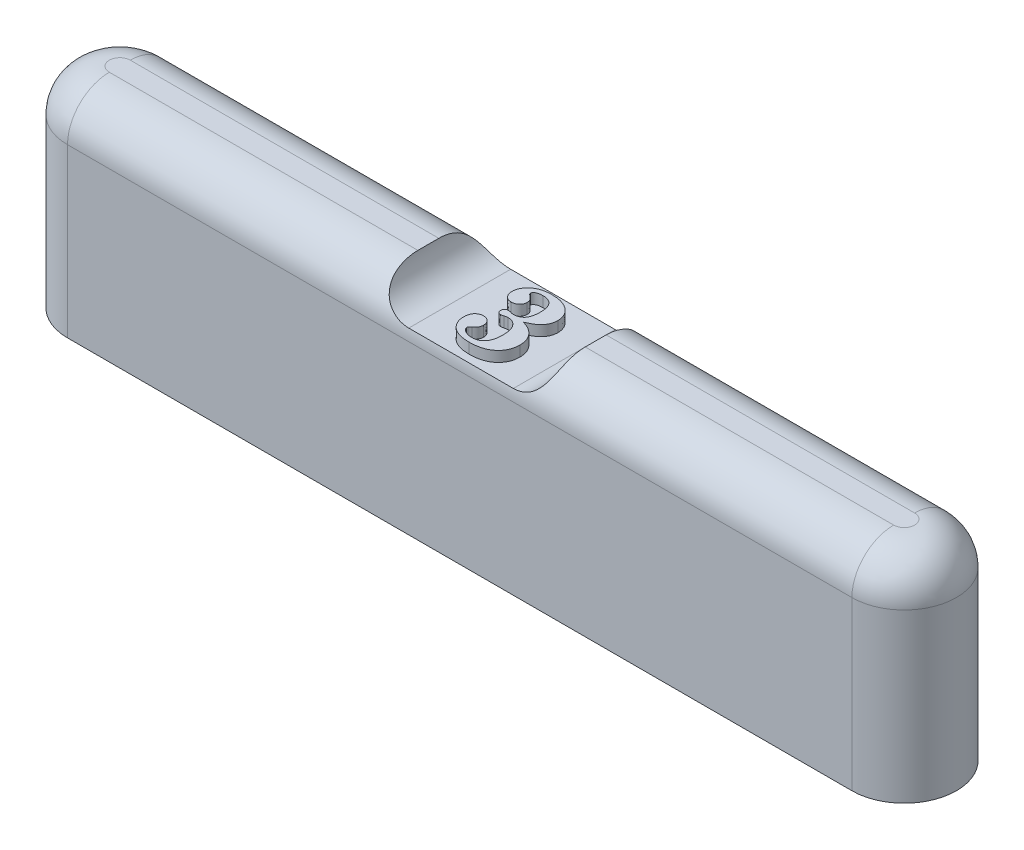
from build123d import *

# Parameters (mm, degrees)
BOSS_EXTRUDE1_DEPTH     = 20
FILLET1_R               = 4
SKETCH2_R               = 2.75
CUT_EXTRUDE1_DEPTH      = 1.5
LPATTERN1_COUNT         = 3
LPATTERN1_PITCH         = 30
CUT_EXTRUDE2_DEPTH      = 48.236109069
CUT_EXTRUDE2_DEPTH_BACK = 48.236109069
WRAP1_DEPTH             = 1


# Read off the part's stored shape, not the designer's step: Wrap1
with BuildPart() as part:
    # Sketch1 → Boss-Extrude1 (new body)
    with BuildSketch(Plane(origin=(0, 0, 0), x_dir=(1, 0, 0), z_dir=(0, 1, 0))):
        with BuildLine():
            Line((37.5, -5), (-37.5, -5))
            ThreePointArc((-37.5, -5), (-42.5, 0), (-37.5, 5))
            Line((-37.5, 5), (37.5, 5))
            ThreePointArc((37.5, 5), (42.5, 0), (37.5, -5))
        make_face()
    extrude(amount=BOSS_EXTRUDE1_DEPTH)

    # Fillet1
    fillet1_edges = [part.edges().sort_by_distance(p)[0] for p in [
        (-42.5, 20, 0),
        (0, 20, 5),
        (42.5, 20, 0),
        (0, 20, -5),
    ]]
    fillet(fillet1_edges, radius=FILLET1_R)

    # Sketch2 → Cut-Extrude1 (cut)
    with BuildSketch(Plane.XZ):
        with Locations(Location((-37.5, 0, 0), (0, 0, 270))):
            Circle(SKETCH2_R)
    cut_extrude1 = extrude(amount=-CUT_EXTRUDE1_DEPTH, mode=Mode.SUBTRACT)

    # LPattern1: Cut-Extrude1 ×3
    with Locations(*[(i * LPATTERN1_PITCH, 0, 0) for i in range(1, LPATTERN1_COUNT)]):
        add(cut_extrude1, mode=Mode.SUBTRACT)

    # Sketch3 → Cut-Extrude2 (cut, two sides: drawn at the far end of the back side and taken through both)
    with BuildSketch(Plane.XY.offset(-CUT_EXTRUDE2_DEPTH_BACK)):
        with BuildLine():
            Line((-5, 23), (5, 23))
            ThreePointArc((5, 23), (8, 20), (5, 17))
            Line((5, 17), (-5, 17))
            ThreePointArc((-5, 17), (-8, 20), (-5, 23))
        make_face()
    extrude(amount=CUT_EXTRUDE2_DEPTH + CUT_EXTRUDE2_DEPTH_BACK, mode=Mode.SUBTRACT)

    # Wrap1 outline → Wrap1 (add)
    with BuildSketch(Plane(origin=(0, 17, 0), x_dir=(1, 0, 0), z_dir=(0, 1, 0))):
        with BuildLine():
            add(Edge.make_bspline(
                [(2.71716785, -1.961133355), (2.714917104, -2.040824799), (2.710502566, -2.197128893), (2.67861502, -2.426281229), (2.62223098, -2.643199541), (2.544100586, -2.848537817), (2.447812244, -3.0439371), (2.322849444, -3.224002982), (2.180633182, -3.395136153), (2.01516107, -3.55167345), (1.830391864, -3.692905147), (1.62760187, -3.816901803), (1.406671678, -3.921188949), (1.168256673, -4.006025687), (0.912348982, -4.071645075), (0.638852791, -4.116939862), (0.348169875, -4.146841164), (0.148335851, -4.150142693), (0.045693491, -4.151838484)],
                knots=[0, 0, 0, 0, 0.061354375, 0.120338389, 0.177702509, 0.233546768, 0.289283374, 0.3449562, 0.401886605, 0.460365064, 0.51992708, 0.580664812, 0.643036542, 0.707697668, 0.775236972, 0.846171603, 0.920987881, 1, 1, 1, 1], degree=3))
            add(Edge.make_bspline(
                [(0.979988362, 0.104571773), (1.050344195, 0.084333241), (1.187855479, 0.044776797), (1.38338152, -0.032288072), (1.566774228, -0.114444049), (1.736010108, -0.207951529), (1.891498578, -0.310848663), (2.035801669, -0.421421094), (2.16517559, -0.543217003), (2.281148573, -0.67385047), (2.383953498, -0.811421355), (2.472334741, -0.956623945), (2.547868662, -1.107801761), (2.611203194, -1.265594984), (2.658869622, -1.430514228), (2.692271377, -1.602161077), (2.713987686, -1.779484024), (2.716100586, -1.900171809), (2.71716785, -1.961133355)],
                knots=[0, 0, 0, 0, 0.075025699, 0.146638589, 0.215271416, 0.280976256, 0.344630791, 0.406315274, 0.467154943, 0.526516949, 0.585236113, 0.643010064, 0.700575913, 0.758349864, 0.817112444, 0.876302356, 0.937518121, 1, 1, 1, 1], degree=3))
            add(Edge.make_bspline(
                [(2.512039645, 1.873802542), (2.507752888, 1.783117182), (2.499290838, 1.604104405), (2.430689157, 1.342964417), (2.318742743, 1.097294696), (2.189931591, 0.906145149), (2.062985591, 0.763780615), (1.953872264, 0.656100386), (1.826201212, 0.557059706), (1.686306897, 0.457935667), (1.530719309, 0.364733719), (1.361259895, 0.272161711), (1.176466601, 0.184873408), (1.046483942, 0.131748847), (0.979988362, 0.104571773)],
                knots=[0, 0, 0, 0, 0.108587554, 0.214351684, 0.321241858, 0.430999345, 0.489069076, 0.549749196, 0.614451706, 0.682490285, 0.755190336, 0.831693801, 0.913899143, 1, 1, 1, 1], degree=3))
            add(Edge.make_bspline(
                [(0.076142209, 3.745597414), (0.198623899, 3.742577347), (0.435971189, 3.736725007), (0.778771911, 3.690157693), (1.095872568, 3.61249552), (1.38452983, 3.501222139), (1.645028465, 3.366120608), (1.87357069, 3.206135522), (2.07031953, 3.024795652), (2.229101748, 2.819264052), (2.354764574, 2.599539567), (2.445498637, 2.367525244), (2.502689235, 2.124431927), (2.50889903, 1.957983921), (2.512039645, 1.873802542)],
                knots=[0, 0, 0, 0, 0.10695053, 0.207250721, 0.301516556, 0.391461648, 0.476821793, 0.557207781, 0.634455968, 0.709589712, 0.783146573, 0.854802433, 0.926566069, 1, 1, 1, 1], degree=3))
            add(Edge.make_bspline(
                [(-1.645011638, 3.139828183), (-1.594468049, 3.188877347), (-1.493220715, 3.287131096), (-1.316714827, 3.408447203), (-1.125380916, 3.51272976), (-0.917956932, 3.600001044), (-0.693066625, 3.6654117), (-0.451501775, 3.710835437), (-0.193290785, 3.740577598), (-0.015290072, 3.743893936), (0.076142209, 3.745597414)],
                knots=[0, 0, 0, 0, 0.112520394, 0.225397328, 0.341295234, 0.46082693, 0.584695833, 0.715280351, 0.853750211, 1, 1, 1, 1], degree=3))
            add(Edge.make_bspline(
                [(-2.103344971, 2.098161516), (-2.102441766, 2.14581505), (-2.100645197, 2.240602949), (-2.076062279, 2.38038819), (-2.04240579, 2.517557704), (-1.989270683, 2.649294264), (-1.925424532, 2.778553807), (-1.845948644, 2.9037315), (-1.753447289, 3.026224881), (-1.681585328, 3.101511523), (-1.645011638, 3.139828183)],
                knots=[0, 0, 0, 0, 0.122161592, 0.242992273, 0.363386459, 0.4840848, 0.606730262, 0.733038715, 0.864131742, 1, 1, 1, 1], degree=3))
            add(Edge.make_bspline(
                [(-1.257191125, 1.18149485), (-1.314710293, 1.184409275), (-1.427596664, 1.190129087), (-1.588679247, 1.240165732), (-1.735720252, 1.320849174), (-1.864583577, 1.432842721), (-1.970099917, 1.571134806), (-2.049284152, 1.729434961), (-2.09419553, 1.908246588), (-2.100219002, 2.033275779), (-2.103344971, 2.098161516)],
                knots=[0, 0, 0, 0, 0.123503177, 0.242385729, 0.359144057, 0.482175805, 0.606759678, 0.731136659, 0.860469416, 1, 1, 1, 1], degree=3))
            add(Edge.make_bspline(
                [(-0.46231933, 1.917071773), (-0.465045215, 1.866039045), (-0.47033756, 1.766958294), (-0.513186735, 1.624506628), (-0.587753153, 1.497637073), (-0.686864947, 1.386132483), (-0.806724466, 1.294026757), (-0.944851832, 1.229944533), (-1.096049202, 1.187615829), (-1.202404107, 1.183575936), (-1.257191125, 1.18149485)],
                knots=[0, 0, 0, 0, 0.126444231, 0.245493237, 0.364814777, 0.488720188, 0.613543272, 0.736823611, 0.86442892, 1, 1, 1, 1], degree=3))
            add(Edge.make_bspline(
                [(-0.891806509, 2.602969209), (-0.851169185, 2.571597297), (-0.775806805, 2.51341773), (-0.679029892, 2.422575825), (-0.602225907, 2.340246161), (-0.546837183, 2.26071239), (-0.508420747, 2.181464029), (-0.480849616, 2.099204671), (-0.46453983, 2.010131451), (-0.463072996, 1.948657428), (-0.46231933, 1.917071773)],
                knots=[0, 0, 0, 0, 0.182070801, 0.337652372, 0.470523462, 0.580943793, 0.680135151, 0.782042625, 0.888012428, 1, 1, 1, 1], degree=3))
            add(Edge.make_bspline(
                [(-1.077703945, 2.851366645), (-1.076949137, 2.830851528), (-1.075566528, 2.793273299), (-1.055936533, 2.747828245), (-1.02700902, 2.716673481), (-0.993565957, 2.685437448), (-0.947910496, 2.645971344), (-0.911740687, 2.618248198), (-0.891806509, 2.602969209)],
                knots=[0, 0, 0, 0, 0.188481556, 0.345248003, 0.443161045, 0.579238055, 0.768106505, 1, 1, 1, 1], degree=3))
            add(Edge.make_bspline(
                [(-0.255588561, 3.232776901), (-0.31868658, 3.23127144), (-0.437318295, 3.228440997), (-0.603726114, 3.207011582), (-0.746298777, 3.169225928), (-0.864529306, 3.117242415), (-0.955233103, 3.054230898), (-1.02472101, 2.991923418), (-1.069230117, 2.92343901), (-1.075008016, 2.874296302), (-1.077703945, 2.851366645)],
                knots=[0, 0, 0, 0, 0.19340588, 0.363625855, 0.512994624, 0.644183797, 0.757282422, 0.849945944, 0.929985784, 1, 1, 1, 1], degree=3))
            add(Edge.make_bspline(
                [(0.973578106, 1.731174337), (0.97293017, 1.794790427), (0.971675601, 1.917967291), (0.954268841, 2.095990977), (0.931853715, 2.261260257), (0.89698004, 2.412765664), (0.849932774, 2.549057412), (0.796049717, 2.672989162), (0.729716346, 2.782404622), (0.654264584, 2.879704468), (0.568277029, 2.963293046), (0.474845333, 3.036040371), (0.37312934, 3.09728924), (0.263392601, 3.147072529), (0.145214104, 3.186031879), (0.018755775, 3.21187131), (-0.115578033, 3.231235003), (-0.207969248, 3.232252482), (-0.255588561, 3.232776901)],
                knots=[0, 0, 0, 0, 0.085873572, 0.166272986, 0.241360724, 0.311004539, 0.375793903, 0.435856468, 0.493138333, 0.548120936, 0.601684393, 0.654642041, 0.707717483, 0.761629576, 0.81706464, 0.875359625, 0.935759162, 1, 1, 1, 1], degree=3))
            add(Edge.make_bspline(
                [(0.681911439, 0.601366645), (0.70577303, 0.631197995), (0.754921033, 0.692641985), (0.813582654, 0.800185855), (0.862717838, 0.921442685), (0.904980331, 1.0557357), (0.933662249, 1.205403777), (0.958903946, 1.367709581), (0.970435253, 1.545115027), (0.972504183, 1.667597284), (0.973578106, 1.731174337)],
                knots=[0, 0, 0, 0, 0.096159815, 0.198061519, 0.307357594, 0.425781566, 0.552299199, 0.691147288, 0.839683351, 1, 1, 1, 1], degree=3))
            add(Edge.make_bspline(
                [(-0.140203945, 0.258417927), (-0.097412529, 0.259151519), (-0.014177564, 0.260578455), (0.107140941, 0.277162029), (0.221219027, 0.303814252), (0.327818055, 0.342991481), (0.42763247, 0.391325014), (0.521894957, 0.448669277), (0.6068836, 0.519677489), (0.656850704, 0.574080902), (0.681911439, 0.601366645)],
                knots=[0, 0, 0, 0, 0.139400172, 0.271151778, 0.398277016, 0.520563852, 0.640497354, 0.759364307, 0.879310449, 1, 1, 1, 1], degree=3))
            add(Edge.make_bspline(
                [(-0.443088561, 0.317712798), (-0.38691904, 0.300302005), (-0.287976995, 0.269633068), (-0.18480505, 0.261802899), (-0.140203945, 0.258417927)],
                knots=[0, 0, 0, 0, 0.567701235, 1, 1, 1, 1], degree=3))
            add(Edge.make_bspline(
                [(-0.675460355, 0.360982029), (-0.642189322, 0.358101661), (-0.56339244, 0.35127999), (-0.487142743, 0.330004798), (-0.443088561, 0.317712798)],
                knots=[0, 0, 0, 0, 0.422237936, 1, 1, 1, 1], degree=3))
            add(Edge.make_bspline(
                [(-1.077703945, -0.007607714), (-1.076651413, 0.021368655), (-1.074655984, 0.076303128), (-1.055186126, 0.152455349), (-1.024608651, 0.217623913), (-0.979899521, 0.270761194), (-0.921453993, 0.311004464), (-0.851342202, 0.342893854), (-0.766766712, 0.356629296), (-0.706994786, 0.359478728), (-0.675460355, 0.360982029)],
                knots=[0, 0, 0, 0, 0.138834815, 0.263208175, 0.374439269, 0.481790582, 0.592071981, 0.712606806, 0.848377303, 1, 1, 1, 1], degree=3))
            add(Edge.make_bspline(
                [(-0.73956292, -0.356966689), (-0.764186463, -0.355484102), (-0.81183396, -0.352615241), (-0.880116413, -0.337795434), (-0.939157672, -0.307538914), (-0.990267316, -0.26767505), (-1.028167193, -0.2146499), (-1.058612695, -0.154558809), (-1.073568679, -0.083606212), (-1.076276998, -0.033832342), (-1.077703945, -0.007607714)],
                knots=[0, 0, 0, 0, 0.134273141, 0.259823658, 0.376868709, 0.492678997, 0.608999304, 0.728652424, 0.857033635, 1, 1, 1, 1], degree=3))
            add(Edge.make_bspline(
                [(-0.439883432, -0.308889766), (-0.47079353, -0.316208274), (-0.528634968, -0.329903251), (-0.610117747, -0.343480507), (-0.678911672, -0.354596571), (-0.72083446, -0.356234822), (-0.73956292, -0.356966689)],
                knots=[0, 0, 0, 0, 0.31333056, 0.586329099, 0.81519791, 1, 1, 1, 1], degree=3))
            add(Edge.make_bspline(
                [(-0.112960355, -0.254402586), (-0.135419025, -0.255134396), (-0.183715216, -0.256708115), (-0.260938013, -0.266756025), (-0.347402943, -0.284985971), (-0.40789499, -0.300621587), (-0.439883432, -0.308889766)],
                knots=[0, 0, 0, 0, 0.202759475, 0.436023603, 0.701766965, 1, 1, 1, 1], degree=3))
            add(Edge.make_bspline(
                [(1.076142209, -1.941902586), (1.075385572, -1.872430623), (1.073922469, -1.738093113), (1.057992817, -1.543154122), (1.030202106, -1.363083667), (0.99663082, -1.195650057), (0.94736708, -1.043433794), (0.891377752, -0.903302367), (0.821043402, -0.778853132), (0.74312161, -0.66770404), (0.655108872, -0.571320569), (0.563232457, -0.485769442), (0.463800781, -0.415342262), (0.360982505, -0.35395079), (0.249698445, -0.310067337), (0.133709412, -0.277755689), (0.012185612, -0.257872314), (-0.070684342, -0.255574708), (-0.112960355, -0.254402586)],
                knots=[0, 0, 0, 0, 0.089659443, 0.173373917, 0.252164698, 0.32478559, 0.393476985, 0.458396676, 0.519206122, 0.577557919, 0.633215921, 0.687389211, 0.739248931, 0.790220988, 0.841564769, 0.893088794, 0.94545937, 1, 1, 1, 1], degree=3))
            add(Edge.make_bspline(
                [(-0.204306509, -3.639017971), (-0.156163719, -3.637826694), (-0.061617943, -3.635487191), (0.075877638, -3.616019097), (0.206206359, -3.58418452), (0.327421557, -3.537508138), (0.441326572, -3.478983133), (0.548194212, -3.408571825), (0.645249169, -3.322599832), (0.736665847, -3.226254433), (0.816533134, -3.114286579), (0.888111872, -2.989282534), (0.9437722, -2.848073643), (0.995610517, -2.695342999), (1.030161239, -2.526686493), (1.058173496, -2.344406382), (1.07384654, -2.147838591), (1.075361842, -2.011906407), (1.076142209, -1.941902586)],
                knots=[0, 0, 0, 0, 0.059792206, 0.117423613, 0.172153936, 0.226142792, 0.27838593, 0.331032237, 0.384664997, 0.439137156, 0.495692256, 0.555129784, 0.617620129, 0.683943919, 0.755285008, 0.831127377, 0.913032156, 1, 1, 1, 1], degree=3))
            add(Edge.make_bspline(
                [(-1.03283215, -3.403441048), (-0.970781485, -3.43968038), (-0.846728382, -3.512130879), (-0.642083884, -3.584220252), (-0.427115571, -3.631646828), (-0.279356098, -3.636535122), (-0.204306509, -3.639017971)],
                knots=[0, 0, 0, 0, 0.24650055, 0.492809516, 0.742389192, 1, 1, 1, 1], degree=3))
            add(Edge.make_bspline(
                [(-1.28283215, -3.049274381), (-1.279544882, -3.081365418), (-1.272793352, -3.147275349), (-1.220609654, -3.240716457), (-1.13956243, -3.327926224), (-1.070257658, -3.376961396), (-1.03283215, -3.403441048)],
                knots=[0, 0, 0, 0, 0.212636247, 0.436721323, 0.695821952, 1, 1, 1, 1], degree=3))
            add(Edge.make_bspline(
                [(-1.05206292, -2.754402586), (-1.076549265, -2.772108653), (-1.12049918, -2.803888818), (-1.180556975, -2.845498588), (-1.219573506, -2.884925046), (-1.256422154, -2.922580839), (-1.279684412, -2.978613586), (-1.281728226, -3.024493359), (-1.28283215, -3.049274381)],
                knots=[0, 0, 0, 0, 0.230116423, 0.41303007, 0.553895719, 0.651787808, 0.811920297, 1, 1, 1, 1], degree=3))
            add(Edge.make_bspline(
                [(-0.667447535, -2.046069253), (-0.668775911, -2.082455831), (-0.671370666, -2.153530789), (-0.688822595, -2.257182885), (-0.720145322, -2.354280917), (-0.761745227, -2.446808981), (-0.816726042, -2.533200063), (-0.882937077, -2.614426099), (-0.96242238, -2.688291765), (-1.02169588, -2.732006582), (-1.05206292, -2.754402586)],
                knots=[0, 0, 0, 0, 0.129765424, 0.253474568, 0.373369941, 0.492719229, 0.614282922, 0.737462889, 0.865496811, 1, 1, 1, 1], degree=3))
            add(Edge.make_bspline(
                [(-1.446293689, -1.280043612), (-1.391582744, -1.282948915), (-1.285417276, -1.288586596), (-1.133485795, -1.328355574), (-0.99862607, -1.39976429), (-0.882150331, -1.496256338), (-0.785484754, -1.61208763), (-0.717693611, -1.745432927), (-0.673179316, -1.890998881), (-0.669395142, -1.99337774), (-0.667447535, -2.046069253)],
                knots=[0, 0, 0, 0, 0.134279191, 0.260566015, 0.381986206, 0.505901784, 0.629817363, 0.749468442, 0.87105847, 1, 1, 1, 1], degree=3))
            add(Edge.make_bspline(
                [(-2.308473176, -2.316902586), (-2.306341379, -2.240219068), (-2.302271409, -2.093816977), (-2.254253983, -1.887544284), (-2.180014421, -1.705651334), (-2.072808402, -1.55326336), (-1.942255927, -1.432177305), (-1.79320671, -1.34259554), (-1.624964154, -1.289685241), (-1.507033249, -1.283321313), (-1.446293689, -1.280043612)],
                knots=[0, 0, 0, 0, 0.151527419, 0.28929203, 0.416768361, 0.538233618, 0.654975674, 0.766880183, 0.879933125, 1, 1, 1, 1], degree=3))
            add(Edge.make_bspline(
                [(0.045693491, -4.151838484), (-0.045180571, -4.150419244), (-0.221921066, -4.147658972), (-0.479411831, -4.122844874), (-0.721493376, -4.084497372), (-0.947179851, -4.025494917), (-1.157894948, -3.95430215), (-1.353452069, -3.866319666), (-1.531586465, -3.759748025), (-1.694002802, -3.639756164), (-1.838171648, -3.506688878), (-1.964275253, -3.363524852), (-2.070429374, -3.210630069), (-2.157609389, -3.049423629), (-2.226059572, -2.879137034), (-2.273344277, -2.699311542), (-2.303209044, -2.510739592), (-2.306700221, -2.382186739), (-2.308473176, -2.316902586)],
                knots=[0, 0, 0, 0, 0.081203508, 0.157932285, 0.231010373, 0.300029536, 0.366164379, 0.429625425, 0.491284509, 0.551349815, 0.609805188, 0.666309249, 0.721540184, 0.775802975, 0.82979833, 0.885159131, 0.941679328, 1, 1, 1, 1], degree=3))
        make_face()
    extrude(amount=WRAP1_DEPTH)


solid = part.part
